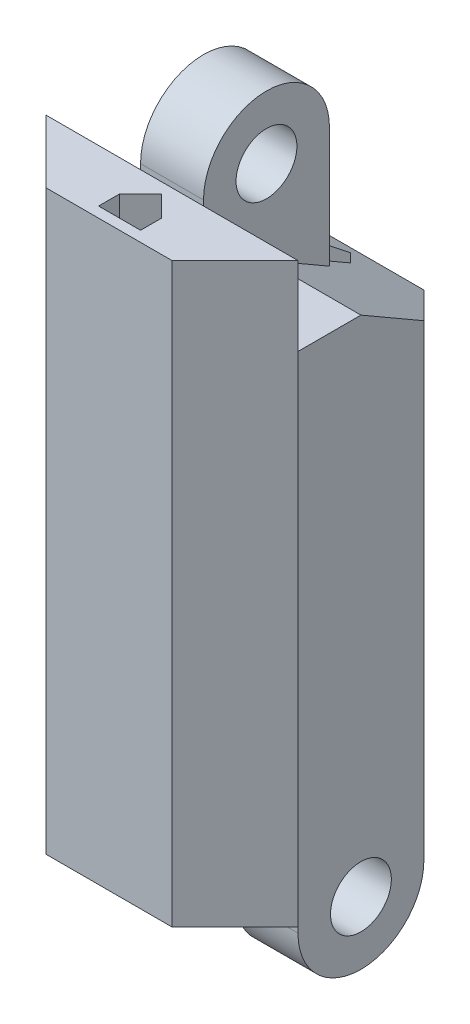
from build123d import *

# Parameters (mm, degrees)
BOSS_EXTRUDE1_DEPTH     = 10
CUT_EXTRUDE2_DEPTH      = 14.114877049
SKETCH6_W               = 3
SKETCH6_H               = 6
BOSS_EXTRUDE3_DEPTH     = 4
SKETCH7_W               = 3
SKETCH7_H               = 3
REVOLVE1_ANGLE          = 180
SKETCH9_R               = 1.45
CUT_EXTRUDE3_DEPTH      = 5
SKETCH10_W              = 3
SKETCH10_H              = 6
BOSS_EXTRUDE4_DEPTH     = 4
SKETCH12_W              = 3
SKETCH12_H              = 3
REVOLVE2_ANGLE          = 180
SKETCH14_R              = 1.45
CUT_EXTRUDE4_DEPTH      = 5
BOSS_EXTRUDE7_DEPTH     = 3.75
BOSS_EXTRUDE17_DEPTH    = 3.75
CUT_EXTRUDE6_DEPTH      = 20
CUT_EXTRUDE6_DEPTH_BACK = 20


with BuildPart() as part:
    # Sketch2 → Boss-Extrude1 (new, symmetric)
    with BuildSketch(Plane(origin=(0, 0, 0), x_dir=(1, 0, 0), z_dir=(0, 1, 0))):
        Polygon((-3, 6), (3, 6), (6, 3), (6, -3), (3, -6), (-3, -6), (-6, -3), (-6, 3), align=None)
    extrude(amount=BOSS_EXTRUDE1_DEPTH, both=True)

    # Sketch5 → Cut-Extrude2 (cut, symmetric)
    with BuildSketch(Plane(origin=(0, 0, 0), x_dir=(0, 0, -1), z_dir=(1, 0, 0))):
        Polygon((0, 10), (6, 6.535898385), (6, 10), align=None)
    cut_extrude2 = extrude(amount=CUT_EXTRUDE2_DEPTH, both=True, mode=Mode.SUBTRACT)

    # Mirror3: Cut-Extrude2 across plane
    add(cut_extrude2.mirror(Plane.ZX), mode=Mode.SUBTRACT)

    # Sketch6 → Boss-Extrude3 (add, symmetric)
    with BuildSketch(Plane.XZ.offset(10)):
        with Locations((-4.5, 0)):
            Rectangle(SKETCH6_W, SKETCH6_H)
    boss_extrude3 = extrude(amount=BOSS_EXTRUDE3_DEPTH, both=True)

    # Sketch7 → Revolve1 (revolve)
    with BuildSketch(Plane.XZ.offset(14)):
        with Locations((-4.5, 1.5)):
            Rectangle(SKETCH7_W, SKETCH7_H)
    revolve1 = revolve(axis=Axis((-6, -14, 0), (1, 0, 0)), revolution_arc=REVOLVE1_ANGLE)

    # Sketch9 → Cut-Extrude3 (cut, symmetric)
    with BuildSketch(Plane.ZY.offset(6)):
        with Locations((0, -14)):
            Circle(SKETCH9_R)
    cut_extrude3 = extrude(amount=CUT_EXTRUDE3_DEPTH, both=True, mode=Mode.SUBTRACT)

    # Mirror5: Boss-Extrude3, Revolve1, Cut-Extrude3 across plane
    add(boss_extrude3.mirror(Plane(origin=(0, 0, 0), x_dir=(0, 0, 1), z_dir=(1, 0, 0))))
    add(revolve1.mirror(Plane(origin=(0, 0, 0), x_dir=(0, 0, 1), z_dir=(1, 0, 0))))
    add(cut_extrude3.mirror(Plane(origin=(0, 0, 0), x_dir=(0, 0, 1), z_dir=(1, 0, 0))), mode=Mode.SUBTRACT)

    # Sketch10 → Boss-Extrude4 (add, symmetric)
    with BuildSketch(Plane(origin=(0, 10, 0), x_dir=(1, 0, 0), z_dir=(0, 1, 0))):
        Rectangle(SKETCH10_W, SKETCH10_H)
    extrude(amount=BOSS_EXTRUDE4_DEPTH, both=True)

    # Sketch12 → Revolve2 (revolve)
    with BuildSketch(Plane(origin=(0, 14, 0), x_dir=(1, 0, 0), z_dir=(0, 1, 0))):
        with Locations((0, 1.5)):
            Rectangle(SKETCH12_W, SKETCH12_H)
    revolve(axis=Axis((-1.5, 14, 0), (1, 0, 0)), revolution_arc=REVOLVE2_ANGLE)

    # Sketch14 → Cut-Extrude4 (cut, symmetric)
    with BuildSketch(Plane.ZY.offset(1.5)):
        with Locations((0, 14)):
            Circle(SKETCH14_R)
    extrude(amount=CUT_EXTRUDE4_DEPTH, both=True, mode=Mode.SUBTRACT)

    # Sketch17 → Boss-Extrude7 (add)
    with BuildSketch(Plane(origin=(0, 10, 0), x_dir=(1, 0, 0), z_dir=(0, 1, 0))):
        Polygon((-6, -3), (-1.5, -3), (1.5, -3), (6, -3), (3, -6), (-3, -6), align=None)
    extrude(amount=BOSS_EXTRUDE7_DEPTH)

    # Sketch19 → Boss-Extrude17 (add)
    with BuildSketch(Plane.XZ.offset(10)):
        Polygon((-6, 3), (-3, 3), (3, 3), (6, 3), (3, 6), (-3, 6), align=None)
    extrude(amount=BOSS_EXTRUDE17_DEPTH)

    # Sketch15 → Cut-Extrude6 (cut, two sides: drawn at the far end of the back side and taken through both)
    with BuildSketch(Plane(origin=(0, 0, 0), x_dir=(1, 0, 0), z_dir=(0, 1, 0)).offset(-CUT_EXTRUDE6_DEPTH_BACK)):
        Polygon((0, 5.5), (-1, 4.5), (-1, 3.5), (1, 3.5), (1, 4.5), align=None)
        Polygon((1, -4.5), (0, -3.5), (-1, -4.5), (-1, -5.5), (1, -5.5), align=None)
    extrude(amount=CUT_EXTRUDE6_DEPTH + CUT_EXTRUDE6_DEPTH_BACK, mode=Mode.SUBTRACT)


solid = part.part
